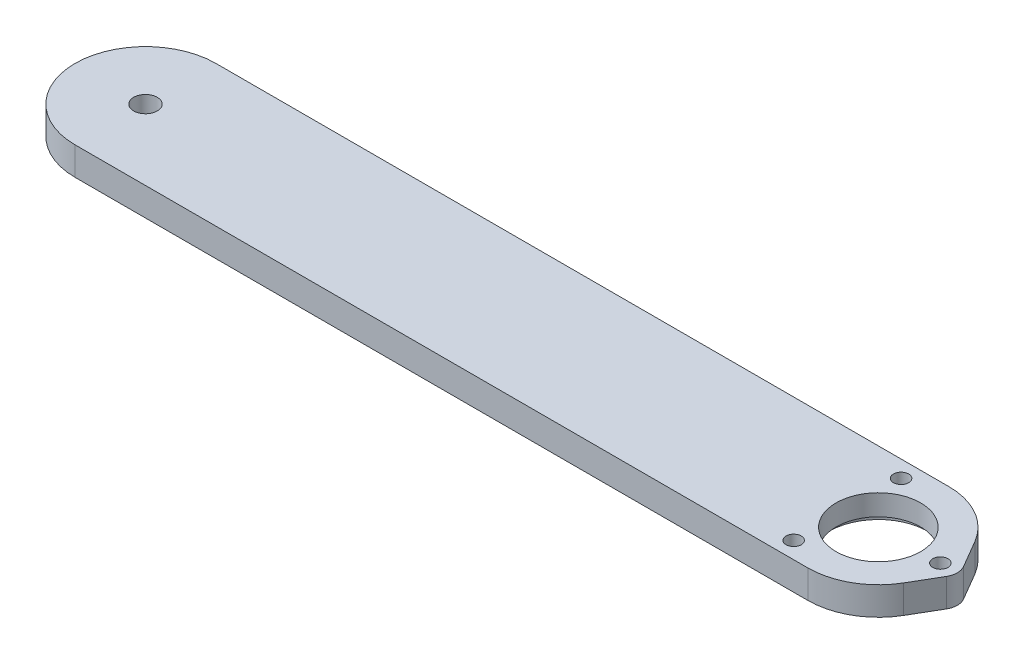
from build123d import *

# Parameters (mm, degrees)
EXTRUDE_1_DEPTH     = 5
EXTRUDE_5_DEPTH     = 5
CUT_EXTRUDE_2_REACH = 82.139
SKETCH_7_R          = 7.5
SKETCH_8_R          = 8.75
CUT_EXTRUDE_3_DEPTH = 1.3
CUT_EXTRUDE_4_REACH = 82.139
SKETCH_9_R          = 1.35
CUT_EXTRUDE_5_REACH = 82.139
SKETCH_12_R         = 2.1
SKETCH_14_W         = 40
SKETCH_14_H         = 7
EXTRUDE_6_DEPTH     = 15
CHAMFER_1_SIZE      = 7
CHAMFER_1_SIZE2     = 3
CUT_EXTRUDE_6_REACH = 134.447
SKETCH_15_R         = 2
FILLET_3_R          = 2
CHAMFER_2_SIZE      = 5
CUT_EXTRUDE_7_DEPTH = 15


with BuildPart() as part:
    # 草图1 → 凸台-拉伸1 (new body)
    with BuildSketch(Plane(origin=(0, 0, 0), x_dir=(1, 0, 0), z_dir=(0, 1, 0))):
        with BuildLine():
            Line((-65, 12.5), (65, 12.5))
            ThreePointArc((65, 12.5), (77.5, 0), (65, -12.5))
            Line((65, -12.5), (-65, -12.5))
            ThreePointArc((-65, -12.5), (-77.5, 0), (-65, 12.5))
        make_face()
    extrude(amount=EXTRUDE_1_DEPTH)

    # 草图10 → 凸台-拉伸5 (add)
    with BuildSketch(Plane.XZ):
        with BuildLine():
            Line((75.795454545, -6.301441197), (78.590909091, -1.512345887))
            ThreePointArc((78.590909091, -1.512345887), (79, 0), (78.590909091, 1.512345887))
            Line((78.590909091, 1.512345887), (75.795454545, 6.301441197))
            Line((75.795454545, 6.301441197), (75.795454545, -6.301441197))
        make_face()
    extrude(amount=-EXTRUDE_5_DEPTH)

    # 草图7 → 切除-拉伸2 (cut, up to next)
    with BuildSketch(Plane(origin=(0, 5, 0), x_dir=(1, 0, 0), z_dir=(0, 1, 0)), mode=Mode.PRIVATE) as cut_extrude_2_sk1:
        with Locations(Location((65, 0, 0), (0, 0, 270))):
            Circle(SKETCH_7_R)
    cut_extrude_2_tool1 = extrude(cut_extrude_2_sk1.sketch, amount=-CUT_EXTRUDE_2_REACH, mode=Mode.PRIVATE) & part.part
    add(cut_extrude_2_tool1.solids().sort_by_distance((65, 5, 0))[0], mode=Mode.SUBTRACT)

    # 草图8 → 切除-拉伸3 (cut)
    with BuildSketch(Plane(origin=(0, 0, 0), x_dir=(1, 0, 0), z_dir=(0, 1, 0))):
        with Locations(Location((65, 0, 0), (0, 0, 270))):
            Circle(SKETCH_8_R)
    extrude(amount=CUT_EXTRUDE_3_DEPTH, mode=Mode.SUBTRACT)

    # 草图9 → 切除-拉伸4 (cut, up to next)
    with BuildSketch(Plane.XZ, mode=Mode.PRIVATE) as cut_extrude_4_sk1:
        with Locations(Location((59.5, 9.526279442, 0), (0, 0, 270))):
            Circle(SKETCH_9_R)
    cut_extrude_4_tool1 = extrude(cut_extrude_4_sk1.sketch, amount=-CUT_EXTRUDE_4_REACH, mode=Mode.PRIVATE) & part.part
    # 草图9 → 切除-拉伸4 (cut, up to next)
    with BuildSketch(Plane.XZ, mode=Mode.PRIVATE) as cut_extrude_4_sk2:
        with Locations(Location((76, 0, 0), (0, 0, 270))):
            Circle(SKETCH_9_R)
    cut_extrude_4_tool2 = extrude(cut_extrude_4_sk2.sketch, amount=-CUT_EXTRUDE_4_REACH, mode=Mode.PRIVATE) & part.part
    # 草图9 → 切除-拉伸4 (cut, up to next)
    with BuildSketch(Plane.XZ, mode=Mode.PRIVATE) as cut_extrude_4_sk3:
        with Locations(Location((59.5, -9.526279442, 0), (0, 0, 270))):
            Circle(SKETCH_9_R)
    cut_extrude_4_tool3 = extrude(cut_extrude_4_sk3.sketch, amount=-CUT_EXTRUDE_4_REACH, mode=Mode.PRIVATE) & part.part
    add(cut_extrude_4_tool1.solids().sort_by_distance((59.5, 0, 9.526279))[0], mode=Mode.SUBTRACT)
    add(cut_extrude_4_tool2.solids().sort_by_distance((76, 0, 0))[0], mode=Mode.SUBTRACT)
    add(cut_extrude_4_tool3.solids().sort_by_distance((59.5, 0, -9.526279))[0], mode=Mode.SUBTRACT)

    # 草图12 → 切除-拉伸5 (cut, up to next)
    with BuildSketch(Plane(origin=(0, 5, 0), x_dir=(1, 0, 0), z_dir=(0, 1, 0)), mode=Mode.PRIVATE) as cut_extrude_5_sk1:
        with Locations(Location((-65, 0, 0), (0, 0, 270))):
            Circle(SKETCH_12_R)
    cut_extrude_5_tool1 = extrude(cut_extrude_5_sk1.sketch, amount=-CUT_EXTRUDE_5_REACH, mode=Mode.PRIVATE) & part.part
    add(cut_extrude_5_tool1.solids().sort_by_distance((-65, 5, 0))[0], mode=Mode.SUBTRACT)

    # 草图14 → 凸台-拉伸6 (add)
    with BuildSketch(Plane.XZ):
        with Locations((-32, -9)):
            Rectangle(SKETCH_14_W, SKETCH_14_H)
    extrude(amount=EXTRUDE_6_DEPTH)

    # 倒角1
    chamfer_1_edges = [part.edges().sort_by_distance(p)[0] for p in [
        (-52, -7.5, -5.5),
    ]]
    chamfer_1_side = [part.faces().sort_by_distance(p)[0] for p in [
        (-32, -7.5, -5.5),
    ]]
    chamfer(chamfer_1_edges, length=CHAMFER_1_SIZE, length2=CHAMFER_1_SIZE2, reference=chamfer_1_side[0])

    # 草图15 → 切除-拉伸6 (cut, up to next)
    with BuildSketch(Plane.ZY.offset(52), mode=Mode.PRIVATE) as cut_extrude_6_sk1:
        with Locations((-4.5, -12.5)):
            Circle(SKETCH_15_R)
    cut_extrude_6_tool1 = extrude(cut_extrude_6_sk1.sketch, amount=-CUT_EXTRUDE_6_REACH, mode=Mode.PRIVATE) & part.part
    add(cut_extrude_6_tool1.solids().sort_by_distance((-52, -12.5, -4.5))[0], mode=Mode.SUBTRACT)

    # 圆角3
    fillet_3_edges = [part.edges().sort_by_distance(p)[0] for p in [
        (-52, -7.5, -8.5),
        (-52, -7.5, -12.5),
        (-45, -14.616025404, -5.5),
        (-45, -5.383974596, -5.5),
        (-12, -5.383974596, -5.5),
        (-12, -7.5, -12.5),
    ]]
    fillet(fillet_3_edges, radius=FILLET_3_R - 0.0001)  # a hair under: the kernel refuses the full size

    # 倒角2
    chamfer_2_edges = [part.edges().sort_by_distance(p)[0] for p in [
        (-52, 0, -10.159413188),
        (-48.082601766, 0, -6.821115043),
        (-29.294702561, 0, -5.5),
        (-12, 0, -9),
        (-51.6696987, 0, -8.717799408),
        (-51.414242852, 0, -11.914242852),
        (-44.99161676, 0, -5.540842512),
        (-12.585757148, 0, -6.085757148),
        (-12.585757148, 0, -11.914242852),
    ]]
    chamfer(chamfer_2_edges, length=CHAMFER_2_SIZE)

    # 草图16 → 切除-拉伸7 (cut)
    with BuildSketch(Plane.XZ.offset(15)):
        Polygon((-61.333333333, -12.5), (-33.333333333, -0.5), (-61.333333333, -0.5), align=None)
    extrude(amount=-CUT_EXTRUDE_7_DEPTH, mode=Mode.SUBTRACT)


solid = part.part
